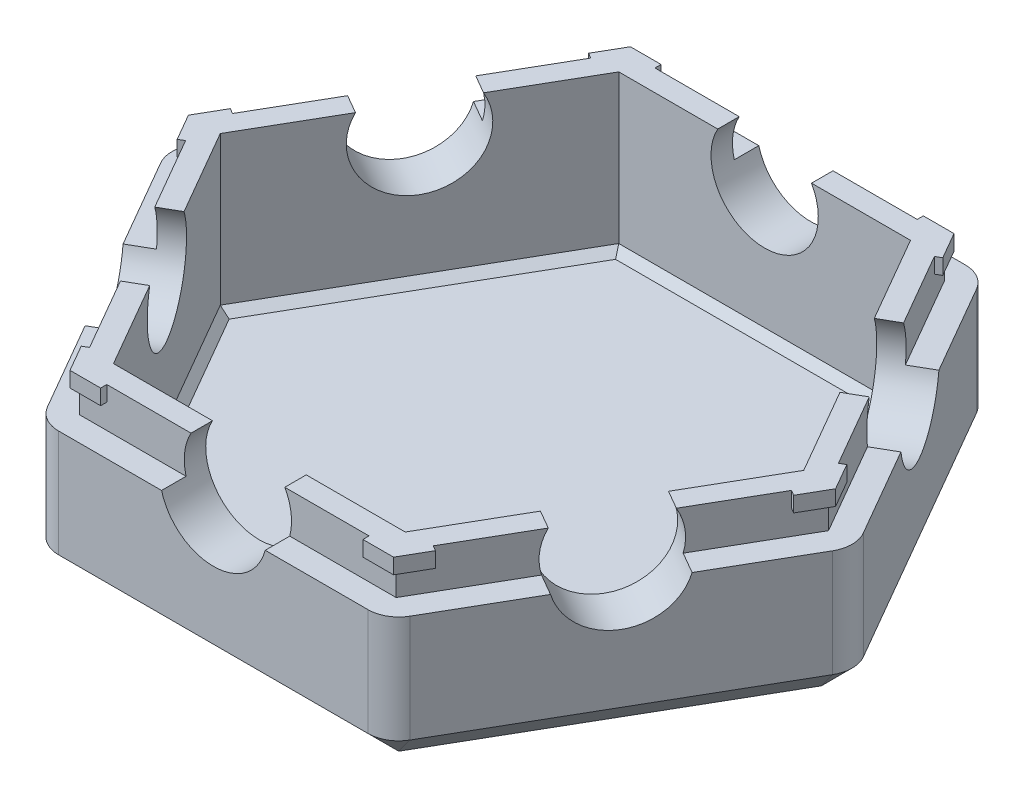
from build123d import *

# Parameters (mm, degrees)
BOSS_EXTRUDE1_START = -3.7
BOSS_EXTRUDE1_DEPTH = 10
CUT_EXTRUDE1_DEPTH  = 8.6
BOSS_EXTRUDE2_DEPTH = 1.6
FILLET1_R           = 2
CUT_EXTRUDE4_START  = -1
CUT_EXTRUDE4_DEPTH  = 1
CUT_EXTRUDE3_REACH  = 48.892
SKETCH4_R           = 3.5
CIRPATTERN1_COUNT   = 6
CHAMFER1_SIZE       = 0.5
CHAMFER2_SIZE       = 2
BOSS_EXTRUDE3_DEPTH = 1


with BuildPart() as part:
    # Sketch1 → Boss-Extrude1 (new body)
    with BuildSketch(Plane(origin=(0, 0, 0), x_dir=(1, 0, 0), z_dir=(0, 1, 0)).offset(BOSS_EXTRUDE1_START)):
        Polygon((22.5, 0), (11.25, 19.485571585), (-11.25, 19.485571585), (-22.5, 0), (-11.25, -19.485571585), (11.25, -19.485571585), align=None)
    extrude(amount=-BOSS_EXTRUDE1_DEPTH)

    # Sketch2 → Cut-Extrude1 (cut)
    with BuildSketch(Plane(origin=(0, -3.7, 0), x_dir=(1, 0, 0), z_dir=(0, 1, 0))):
        Polygon((9.517949192, -16.485571585), (19.035898385, 0), (9.517949192, 16.485571585), (-9.517949192, 16.485571585), (-19.035898385, 0), (-9.517949192, -16.485571585), align=None)
    extrude(amount=-CUT_EXTRUDE1_DEPTH, mode=Mode.SUBTRACT)

    # Sketch3 → Boss-Extrude2 (add)
    with BuildSketch(Plane(origin=(0, -3.7, 0), x_dir=(1, 0, 0), z_dir=(0, 1, 0))):
        Polygon((10.326239569, -17.885571585), (20.652479139, 0), (10.326239569, 17.885571585), (-10.326239569, 17.885571585), (-20.652479139, 0), (-10.326239569, -17.885571585), align=None)
        Polygon((-9.517949192, -16.485571585), (9.517949192, -16.485571585), (19.035898385, 0), (9.517949192, 16.485571585), (-9.517949192, 16.485571585), (-19.035898385, 0), align=None, mode=Mode.SUBTRACT)
    extrude(amount=BOSS_EXTRUDE2_DEPTH)

    # Fillet1
    fillet1_edges = [part.edges().sort_by_distance(p)[0] for p in [
        (22.5, -8.7, 0),
        (11.25, -8.7, 19.485571585),
        (-11.25, -8.7, 19.485571585),
        (-22.5, -8.7, 0),
        (-11.25, -8.7, -19.485571585),
        (11.25, -8.7, -19.485571585),
    ]]
    fillet(fillet1_edges, radius=FILLET1_R)

    # Sketch6 → Cut-Extrude4 (cut)
    with BuildSketch(Plane(origin=(0, -3.7, 0), x_dir=(1, 0, 0), z_dir=(0, 1, 0)).offset(CUT_EXTRUDE4_START)):
        with BuildLine():
            Line((11.827350269, -18.485571585), (21.922649731, -1))
            ThreePointArc((21.922649731, -1), (22.190598923, 0), (21.922649731, 1))
            Line((21.922649731, 1), (11.827350269, 18.485571585))
            ThreePointArc((11.827350269, 18.485571585), (11.095299462, 19.217622393), (10.095299462, 19.485571585))
            Line((10.095299462, 19.485571585), (-10.095299462, 19.485571585))
            ThreePointArc((-10.095299462, 19.485571585), (-11.095299462, 19.217622393), (-11.827350269, 18.485571585))
            Line((-11.827350269, 18.485571585), (-21.922649731, 1))
            ThreePointArc((-21.922649731, 1), (-22.190598923, 0), (-21.922649731, -1))
            Line((-21.922649731, -1), (-11.827350269, -18.485571585))
            ThreePointArc((-11.827350269, -18.485571585), (-11.095299462, -19.217622393), (-10.095299462, -19.485571585))
            Line((-10.095299462, -19.485571585), (10.095299462, -19.485571585))
            ThreePointArc((10.095299462, -19.485571585), (11.095299462, -19.217622393), (11.827350269, -18.485571585))
        make_face()
        Polygon((10.326239569, -17.885571585), (20.652479139, 0), (10.326239569, 17.885571585), (-10.326239569, 17.885571585), (-20.652479139, 0), (-10.326239569, -17.885571585), align=None, mode=Mode.SUBTRACT)
    extrude(amount=CUT_EXTRUDE4_DEPTH, mode=Mode.SUBTRACT)

    # Sketch4 → Cut-Extrude3 (cut, up to next)
    with BuildSketch(Plane(origin=(0, 0, -19.485571585), x_dir=(-1, 0, 0), z_dir=(0, 0, -1)), mode=Mode.PRIVATE) as cut_extrude3_sk1:
        with Locations((0, -3.8)):
            Circle(SKETCH4_R)
    cut_extrude3_tool1 = extrude(cut_extrude3_sk1.sketch, amount=-CUT_EXTRUDE3_REACH, mode=Mode.PRIVATE) & part.part
    cut_extrude3 = cut_extrude3_tool1.solids().sort_by_distance((0, -3.8, -19.485572))[0]
    add(cut_extrude3, mode=Mode.SUBTRACT)

    # CirPattern1: Cut-Extrude3 ×6 about axis
    cirpattern1_axis = Axis((0, -14.28, 0), (0, 1, 0))
    for i in range(1, CIRPATTERN1_COUNT):
        add(cut_extrude3.rotate(cirpattern1_axis, i * 360 / CIRPATTERN1_COUNT), mode=Mode.SUBTRACT)

    # Chamfer1
    chamfer1_edges = [part.edges().sort_by_distance(p)[0] for p in [
        (-14.276923789, -12.3, 8.242785793),
        (-14.276923789, -12.3, -8.242785793),
        (0, -12.3, -16.485571585),
        (14.276923789, -12.3, -8.242785793),
        (14.276923789, -12.3, 8.242785793),
        (0, -12.3, 16.485571585),
    ]]
    chamfer(chamfer1_edges, length=CHAMFER1_SIZE)

    # Chamfer2
    chamfer2_edges = [part.edges().sort_by_distance(p)[0] for p in [
        (0, -13.7, 19.485571585),
        (11.095299462, -13.7, 19.217622393),
        (-11.095299462, -13.7, 19.217622393),
        (16.875, -13.7, 9.742785793),
        (-16.875, -13.7, 9.742785793),
        (22.190598923, -13.7, 0),
        (-22.190598923, -13.7, 0),
        (16.875, -13.7, -9.742785793),
        (-16.875, -13.7, -9.742785793),
        (11.095299462, -13.7, -19.217622393),
        (-11.095299462, -13.7, -19.217622393),
        (0, -13.7, -19.485571585),
    ]]
    chamfer(chamfer2_edges, length=CHAMFER2_SIZE)

    # Sketch7 → Boss-Extrude3 (add)
    with BuildSketch(Plane(origin=(0, -2.1, 0), x_dir=(1, 0, 0), z_dir=(0, 1, 0))):
        Polygon((8.557179677, 17.885571585), (8.557179677, 18.285571585), (10.557179677, 18.285571585), (11.557179677, 16.553520778), (11.210769515, 16.353520778), (10.326239569, 17.885571585), align=None)
        Polygon((20.114359354, -1.732050808), (21.114359354, 0), (20.114359354, 1.732050808), (19.767949192, 1.532050808), (20.652479139, 0), (19.767949192, -1.532050808), align=None)
        Polygon((8.557179677, -18.285571585), (10.557179677, -18.285571585), (11.557179677, -16.553520778), (11.210769515, -16.353520778), (10.326239569, -17.885571585), (8.557179677, -17.885571585), align=None)
        Polygon((-11.557179677, -16.553520778), (-10.557179677, -18.285571585), (-8.557179677, -18.285571585), (-8.557179677, -17.885571585), (-10.326239569, -17.885571585), (-11.210769515, -16.353520778), align=None)
        Polygon((-20.114359354, 1.732050808), (-21.114359354, 0), (-20.114359354, -1.732050808), (-19.767949192, -1.532050808), (-20.652479139, 0), (-19.767949192, 1.532050808), align=None)
        Polygon((-8.557179677, 18.285571585), (-10.557179677, 18.285571585), (-11.557179677, 16.553520778), (-11.210769515, 16.353520778), (-10.326239569, 17.885571585), (-8.557179677, 17.885571585), align=None)
    extrude(amount=-BOSS_EXTRUDE3_DEPTH)


solid = part.part
